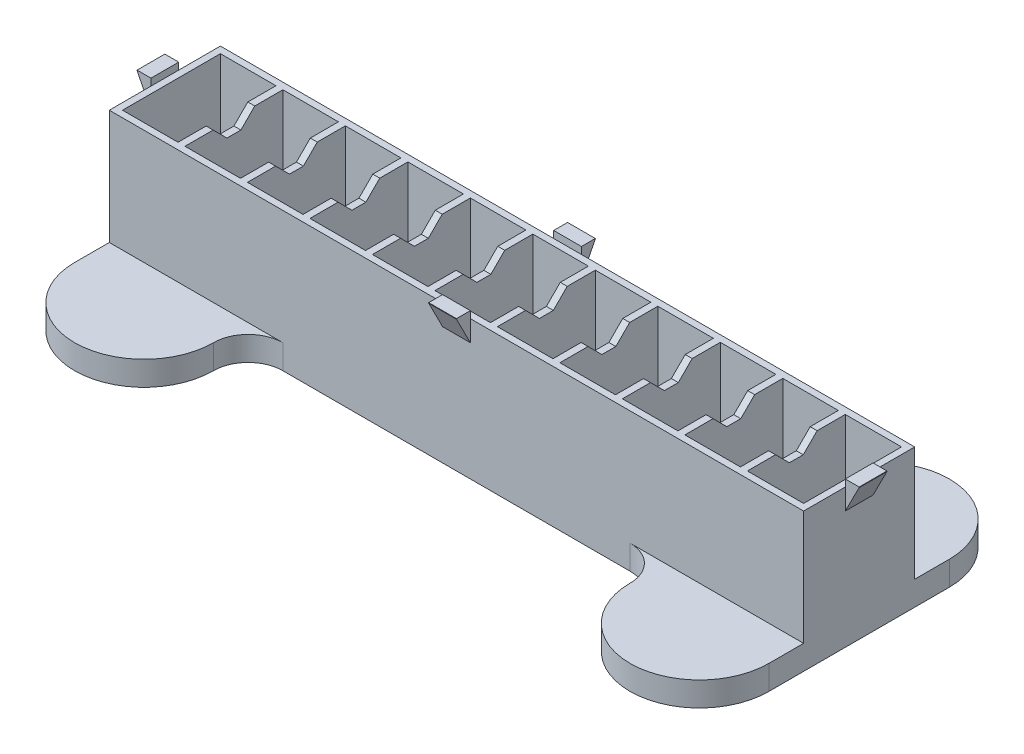
from build123d import *
from OCP.BRepFilletAPI import BRepFilletAPI_MakeChamfer

# Parameters (mm, degrees)
SKETCH1_W           = 100
SKETCH1_H           = 16
BOSS_EXTRUDE1_DEPTH = 20
CUT_EXTRUDE2_DEPTH  = 100
SKETCH3_W           = 0.95
SKETCH3_H           = 16
BOSS_EXTRUDE2_DEPTH = 20
SKETCH4_W           = 1
SKETCH4_H           = 14.1
BOSS_EXTRUDE3_DEPTH = 20
SKETCH5_W           = 95
SKETCH5_H           = 2
CUT_EXTRUDE3_DEPTH  = 2
BOSS_EXTRUDE4_DEPTH = 3.5
FILLET1_R           = 5
FILLET2_SIZE        = 2
SKETCH9_W           = 2
SKETCH9_H           = 4
SKETCH9_W_2         = 4
SKETCH9_H_2         = 2
BOSS_EXTRUDE5_DEPTH = 4
CHAMFER1_SIZE       = 2
CHAMFER1_SIZE_2     = 3.925221011


with BuildPart() as part:
    # Sketch1 → Boss-Extrude1 (new body)
    with BuildSketch(Plane(origin=(0, 0, 0), x_dir=(1, 0, 0), z_dir=(0, 1, 0))):
        with Locations((-225.058823529, 103.529411765)):
            Rectangle(SKETCH1_W, SKETCH1_H)
    extrude(amount=BOSS_EXTRUDE1_DEPTH)

    # Sketch2 → Cut-Extrude2 (cut)
    with BuildSketch(Plane.ZY.offset(275.058823529)):
        with BuildLine():
            Line((-110.579411765, 20), (-96.479411765, 20))
            Line((-96.479411765, 20), (-96.479411765, 8))
            ThreePointArc((-96.479411765, 8), (-103.529411765, 0.95), (-110.579411765, 8))
            Line((-110.579411765, 8), (-110.579411765, 20))
        make_face()
    extrude(amount=-CUT_EXTRUDE2_DEPTH, mode=Mode.SUBTRACT)

    # Sketch3 → Boss-Extrude2 (add)
    with BuildSketch(Plane(origin=(0, 20, 0), x_dir=(1, 0, 0), z_dir=(0, 1, 0))):
        with Locations((-175.533823529, 103.529411765)):
            Rectangle(SKETCH3_W, SKETCH3_H)
        with Locations((-274.583823529, 103.529411765)):
            Rectangle(SKETCH3_W, SKETCH3_H)
    extrude(amount=-BOSS_EXTRUDE2_DEPTH)

    # Sketch4 → Boss-Extrude3 (add)
    with BuildSketch(Plane(origin=(0, 20, 0), x_dir=(1, 0, 0), z_dir=(0, 1, 0))):
        with Locations((-265.608823529, 103.529411765)):
            Rectangle(SKETCH4_W, SKETCH4_H)
        with Locations((-256.608823529, 103.529411765)):
            Rectangle(SKETCH4_W, SKETCH4_H)
        with Locations((-247.608823529, 103.529411765)):
            Rectangle(SKETCH4_W, SKETCH4_H)
        with Locations((-238.608823529, 103.529411765)):
            Rectangle(SKETCH4_W, SKETCH4_H)
        with Locations((-229.608823529, 103.529411765)):
            Rectangle(SKETCH4_W, SKETCH4_H)
        with Locations((-220.608823529, 103.529411765)):
            Rectangle(SKETCH4_W, SKETCH4_H)
        with Locations((-211.608823529, 103.529411765)):
            Rectangle(SKETCH4_W, SKETCH4_H)
        with Locations((-202.608823529, 103.529411765)):
            Rectangle(SKETCH4_W, SKETCH4_H)
        with Locations((-193.608823529, 103.529411765)):
            Rectangle(SKETCH4_W, SKETCH4_H)
        with Locations((-184.608823529, 103.529411765)):
            Rectangle(SKETCH4_W, SKETCH4_H)
    extrude(amount=-BOSS_EXTRUDE3_DEPTH)

    # Sketch5 → Cut-Extrude3 (cut)
    with BuildSketch(Plane(origin=(0, 20, 0), x_dir=(1, 0, 0), z_dir=(0, 1, 0))):
        with Locations((-225.058823529, 103.529411765)):
            Rectangle(SKETCH5_W, SKETCH5_H)
    extrude(amount=-CUT_EXTRUDE3_DEPTH, mode=Mode.SUBTRACT)

    # Sketch6 → Boss-Extrude4 (add)
    with BuildSketch(Plane.XZ):
        with BuildLine():
            Line((-275.058823529, -90.529411765), (-275.058823529, -95.529411765))
            Line((-275.058823529, -95.529411765), (-255.058823529, -95.529411765))
            Line((-255.058823529, -95.529411765), (-255.058823529, -90.529411765))
            ThreePointArc((-255.058823529, -90.529411765), (-265.058823529, -80.529411765), (-275.058823529, -90.529411765))
        make_face()
        with BuildLine():
            Line((-175.058823529, -111.529411765), (-175.058823529, -116.529411765))
            ThreePointArc((-175.058823529, -116.529411765), (-185.058823529, -126.529411765), (-195.058823529, -116.529411765))
            Line((-195.058823529, -116.529411765), (-195.058823529, -111.529411765))
            Line((-195.058823529, -111.529411765), (-175.058823529, -111.529411765))
        make_face()
        with BuildLine():
            Line((-195.058823529, -90.529411765), (-195.058823529, -95.529411765))
            Line((-195.058823529, -95.529411765), (-175.058823529, -95.529411765))
            Line((-175.058823529, -95.529411765), (-175.058823529, -90.529411765))
            ThreePointArc((-175.058823529, -90.529411765), (-185.058823529, -80.529411765), (-195.058823529, -90.529411765))
        make_face()
        with BuildLine():
            Line((-275.058823529, -111.529411765), (-255.058823529, -111.529411765))
            Line((-255.058823529, -111.529411765), (-255.058823529, -116.529411765))
            ThreePointArc((-255.058823529, -116.529411765), (-265.058823529, -126.529411765), (-275.058823529, -116.529411765))
            Line((-275.058823529, -116.529411765), (-275.058823529, -111.529411765))
        make_face()
    extrude(amount=-BOSS_EXTRUDE4_DEPTH)

    # Fillet1
    fillet1_edges = [part.edges().sort_by_distance(p)[0] for p in [
        (-195.058823529, 1.75, -95.529411765),
        (-255.058823529, 1.75, -95.529411765),
        (-255.058823529, 1.75, -111.529411765),
        (-195.058823529, 1.75, -111.529411765),
    ]]
    fillet(fillet1_edges, radius=FILLET1_R - 0.0001)  # a hair under: the kernel refuses the full size

    # Fillet2
    fillet2_edges = [part.edges().sort_by_distance(p)[0] for p in [
        (-238.608823529, 20, -102.529411765),
        (-238.608823529, 20, -104.529411765),
        (-202.608823529, 20, -102.529411765),
        (-202.608823529, 20, -104.529411765),
        (-184.608823529, 20, -102.529411765),
        (-184.608823529, 20, -104.529411765),
        (-193.608823529, 20, -102.529411765),
        (-193.608823529, 20, -104.529411765),
        (-211.608823529, 20, -104.529411765),
        (-211.608823529, 20, -102.529411765),
        (-220.608823529, 20, -102.529411765),
        (-220.608823529, 20, -104.529411765),
        (-229.608823529, 20, -102.529411765),
        (-229.608823529, 20, -104.529411765),
        (-247.608823529, 20, -104.529411765),
        (-247.608823529, 20, -102.529411765),
        (-256.608823529, 20, -104.529411765),
        (-256.608823529, 20, -102.529411765),
        (-265.608823529, 20, -104.529411765),
        (-265.608823529, 20, -102.529411765),
    ]]
    chamfer(fillet2_edges, length=FILLET2_SIZE - 0.0001)  # a hair under: the kernel refuses the full size

    # Sketch9 → Boss-Extrude5 (add)
    with BuildSketch(Plane(origin=(0, 17, 0), x_dir=(-1, 0, 0), z_dir=(0, 1, 0))):
        with Locations((174.058823529, -103.529411765)):
            Rectangle(SKETCH9_W, SKETCH9_H)
        with Locations((276.058823529, -103.529411765)):
            Rectangle(SKETCH9_W, SKETCH9_H)
        with Locations((225.058823529, -112.529411765)):
            Rectangle(SKETCH9_W_2, SKETCH9_H_2)
        with Locations((225.058823529, -94.529411765)):
            Rectangle(SKETCH9_W_2, SKETCH9_H_2)
    extrude(amount=BOSS_EXTRUDE5_DEPTH)

    # Chamfer1
    chamfer1_edges_1 = [part.edges().sort_by_distance(p)[0] for p in [
        (-225.058823529, 17, -113.529411765),
    ]]
    chamfer1_side_1 = [part.faces().sort_by_distance(p)[0] for p in [
        (-225.058823529, 17, -113.489411765),
    ]]
    chamfer1_edges_2 = [part.edges().sort_by_distance(p)[0] for p in [
        (-173.058823529, 17, -103.529411765),
    ]]
    chamfer1_side_2 = [part.faces().sort_by_distance(p)[0] for p in [
        (-173.098823529, 17, -103.529411765),
    ]]
    chamfer1_edges_3 = [part.edges().sort_by_distance(p)[0] for p in [
        (-225.058823529, 17, -93.529411765),
    ]]
    chamfer1_side_3 = [part.faces().sort_by_distance(p)[0] for p in [
        (-225.058823529, 17, -93.569411765),
    ]]
    chamfer1_edges_4 = [part.edges().sort_by_distance(p)[0] for p in [
        (-277.058823529, 17, -103.529411765),
    ]]
    chamfer1_side_4 = [part.faces().sort_by_distance(p)[0] for p in [
        (-277.018823529, 17, -103.529411765),
    ]]
    chamfer1 = BRepFilletAPI_MakeChamfer(part.part.solid().wrapped)
    for e in chamfer1_edges_1:
        chamfer1.Add(CHAMFER1_SIZE - 0.0001, CHAMFER1_SIZE_2 - 0.0001, e.wrapped, chamfer1_side_1[0].wrapped)
    for e in chamfer1_edges_2:
        chamfer1.Add(CHAMFER1_SIZE - 0.0001, CHAMFER1_SIZE_2 - 0.0001, e.wrapped, chamfer1_side_2[0].wrapped)
    for e in chamfer1_edges_3:
        chamfer1.Add(CHAMFER1_SIZE - 0.0001, CHAMFER1_SIZE_2 - 0.0001, e.wrapped, chamfer1_side_3[0].wrapped)
    for e in chamfer1_edges_4:
        chamfer1.Add(CHAMFER1_SIZE - 0.0001, CHAMFER1_SIZE_2 - 0.0001, e.wrapped, chamfer1_side_4[0].wrapped)
    add(Compound.cast(chamfer1.Shape()), mode=Mode.REPLACE)  # a hair under: the kernel refuses the full size


solid = part.part
